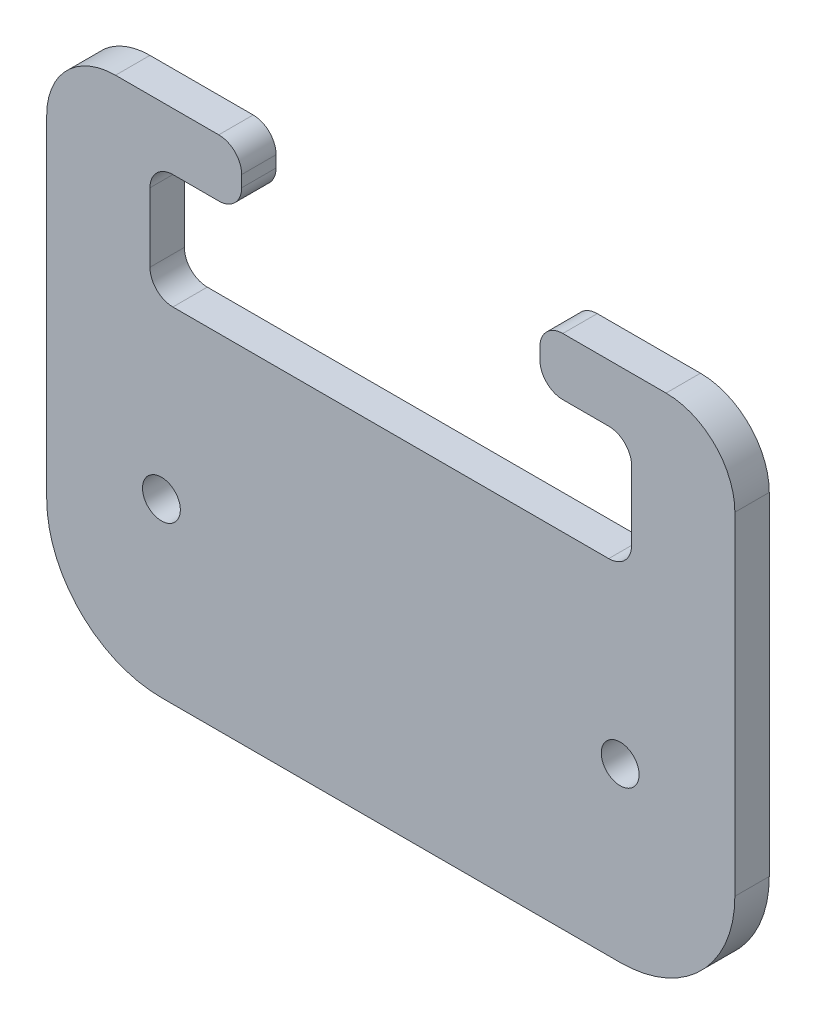
from build123d import *

# Parameters (mm, degrees)
EXTRUDE_1_DEPTH     = 3
FILLET_1_R          = 6
FILLET_2_R          = 2
SKETCH_2_R          = 1.65
CUT_EXTRUDE_1_DEPTH = 5
FILLET_3_R          = 10


with BuildPart() as part:
    # 草图1 → 凸台-拉伸1 (new body)
    with BuildSketch(Plane.XY):
        Polygon((13, 22.5), (30, 22.5), (30, -22.5), (-30, -22.5), (-30, 22.5), (-13, 22.5), (-13, 17.5), (-21, 17.5), (-21, 7.5), (21, 7.5), (21, 17.5), (13, 17.5), align=None)
    extrude(amount=EXTRUDE_1_DEPTH)

    # 圆角1
    fillet_1_edges = [part.edges().sort_by_distance(p)[0] for p in [
        (30, 22.5, 1.5),
        (-30, 22.5, 1.5),
    ]]
    fillet(fillet_1_edges, radius=FILLET_1_R)

    # 圆角2
    fillet_2_edges = [part.edges().sort_by_distance(p)[0] for p in [
        (21, 17.5, 1.5),
        (21, 7.5, 1.5),
        (-21, 7.5, 1.5),
        (-21, 17.5, 1.5),
        (-13, 17.5, 1.5),
        (-13, 22.5, 1.5),
        (13, 17.5, 1.5),
        (13, 22.5, 1.5),
    ]]
    fillet(fillet_2_edges, radius=FILLET_2_R)

    # 草图2 → 切除-拉伸1 (cut)
    with BuildSketch(Plane.XY.offset(3)):
        with Locations((-20, -7.5)):
            Circle(SKETCH_2_R)
        with Locations((20, -7.5)):
            Circle(SKETCH_2_R)
    extrude(amount=-CUT_EXTRUDE_1_DEPTH, mode=Mode.SUBTRACT)

    # 圆角3
    fillet_3_edges = [part.edges().sort_by_distance(p)[0] for p in [
        (-30, -22.5, 1.5),
        (30, -22.5, 1.5),
    ]]
    fillet(fillet_3_edges, radius=FILLET_3_R)


solid = part.part
